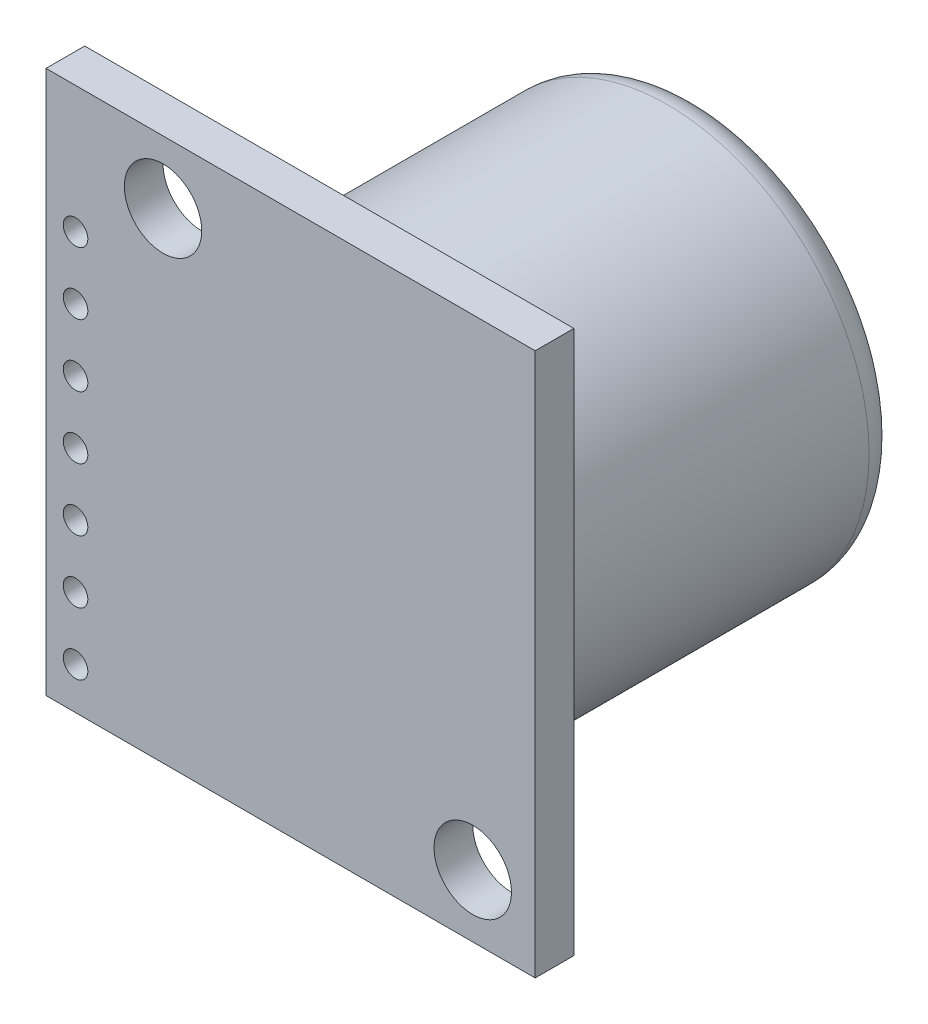
from build123d import *

# Parameters (mm, degrees)
SKETCH1_W           = 19.9
SKETCH1_H           = 22.1
SKETCH1_R           = 1.5748
SKETCH1_R_2         = 0.5
BOSS_EXTRUDE1_DEPTH = 1.5748
SKETCH2_R           = 8.2
BOSS_EXTRUDE2_DEPTH = 13.9192
FILLET2_R           = 1.27


with BuildPart() as part:
    # Sketch1 → Boss-Extrude1 (new body)
    with BuildSketch(Plane.XY):
        Rectangle(SKETCH1_W, SKETCH1_H)
        with Locations((-5.19, 8.49)):
            Circle(SKETCH1_R, mode=Mode.SUBTRACT)
        with Locations((7.41, -8.51)):
            Circle(SKETCH1_R, mode=Mode.SUBTRACT)
        with Locations((-8.75, -9.35)):
            Circle(SKETCH1_R_2, mode=Mode.SUBTRACT)
        with Locations((-8.75, -6.81)):
            Circle(SKETCH1_R_2, mode=Mode.SUBTRACT)
        with Locations((-8.75, -4.27)):
            Circle(SKETCH1_R_2, mode=Mode.SUBTRACT)
        with Locations((-8.75, -1.73)):
            Circle(SKETCH1_R_2, mode=Mode.SUBTRACT)
        with Locations((-8.75, 0.81)):
            Circle(SKETCH1_R_2, mode=Mode.SUBTRACT)
        with Locations((-8.75, 3.35)):
            Circle(SKETCH1_R_2, mode=Mode.SUBTRACT)
        with Locations((-8.75, 5.89)):
            Circle(SKETCH1_R_2, mode=Mode.SUBTRACT)
    extrude(amount=BOSS_EXTRUDE1_DEPTH)

    # Sketch2 → Boss-Extrude2 (add)
    with BuildSketch(Plane(origin=(0, 0, 0), x_dir=(-1, 0, 0), z_dir=(0, 0, -1))):
        with Locations((-1.11, -0.01)):
            Circle(SKETCH2_R)
    extrude(amount=BOSS_EXTRUDE2_DEPTH)

    # Fillet2
    fillet2_edges = [part.edges().sort_by_distance(p)[0] for p in [
        (9.31, -0.01, -13.9192),
    ]]
    fillet(fillet2_edges, radius=FILLET2_R)


solid = part.part
